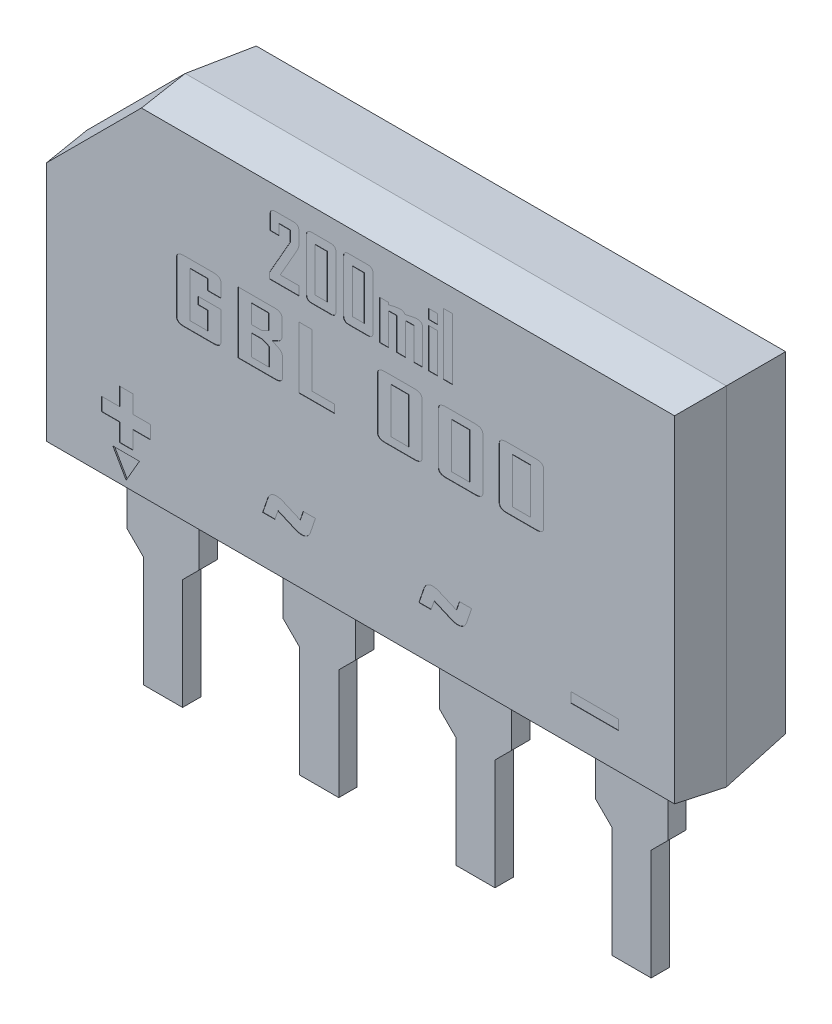
from build123d import *
from OCP.BRepFilletAPI import BRepFilletAPI_MakeChamfer

# Parameters (mm, degrees)
BODY_MAIN_DEPTH            = 1.5
BODY_MAIN_DEPTH_BACK       = 2.2
SKETCH1_W                  = 20.8
SKETCH1_H                  = 11.3
BODY_CHAMFER_SIZE          = 3.2
BODY_CHAMFER1_SIZE         = 1.5
BODY_CHAMFER1_SIZE2        = 0.184176841
BODY_CHAMFER2_SIZE         = 0.270126034
BODY_CHAMFER2_SIZE_2       = 2.2
SKETCH10_W                 = 2.35
SKETCH10_H                 = 0.6
PIN_L1_DEPTH               = 3.2
CHAMFER4_SIZE              = 0.54
SKETCH11_W                 = 1.27
SKETCH11_H                 = 0.6
PIN_STRAIGHT_PATTERN_START = -0.3
PIN_STRAIGHT_PATTERN_DEPTH = 0.6
SKETCH5_W                  = 0.578313253
SKETCH5_H                  = 1.469879518
SKETCH5_W_2                = 0.385542169
SKETCH5_H_2                = 1.421686747
SKETCH5_W_3                = 0.294427711
SKETCH5_H_3                = 0.313253012
SKETCH5_W_4                = 0.289156626
SKETCH5_H_4                = 1.277108434
SKETCH5_H_5                = 2
SKETCH5_W_5                = 1.554216868
SKETCH5_H_6                = 0.325301205
TEXT_2_DEPTH               = 0.01
PIN1_MARK_DEPTH            = 0.04


# Read off the part's stored shape, not the designer's step: PIN_straight_Pattern
with BuildPart() as part:
    # Sketch1 → BODY_MAIN (new, two sides: drawn at the far end of the back side and taken through both)
    with BuildSketch(Plane.XY.offset(-BODY_MAIN_DEPTH_BACK)):
        with Locations((7.62, 8.35)):
            Rectangle(SKETCH1_W, SKETCH1_H)
    extrude(amount=BODY_MAIN_DEPTH + BODY_MAIN_DEPTH_BACK)

    # BODY_Chamfer
    body_chamfer_edges = [part.edges().sort_by_distance(p)[0] for p in [
        (-2.78, 14, -0.35),
    ]]
    chamfer(body_chamfer_edges, length=BODY_CHAMFER_SIZE)

    # BODY_Chamfer1: one chamfer whose edges measure the first distance from different faces: ONE call of the kernel's chamfer builder (chamfer() names one face for all edges)
    body_chamfer1_edges_1 = [part.edges().sort_by_distance(p)[0] for p in [
        (7.62, 2.7, 1.5),
    ]]
    body_chamfer1_side_1 = [part.faces().sort_by_distance(p)[0] for p in [
        (7.62, 2.7, -0.35),
    ]]
    body_chamfer1_edges_2 = [part.edges().sort_by_distance(p)[0] for p in [
        (18.02, 8.35, 1.5),
    ]]
    body_chamfer1_side_2 = [part.faces().sort_by_distance(p)[0] for p in [
        (18.02, 8.35, -0.35),
    ]]
    body_chamfer1_edges_3 = [part.edges().sort_by_distance(p)[0] for p in [
        (9.22, 14, 1.5),
    ]]
    body_chamfer1_side_3 = [part.faces().sort_by_distance(p)[0] for p in [
        (9.22, 14, -0.35),
    ]]
    body_chamfer1_edges_4 = [part.edges().sort_by_distance(p)[0] for p in [
        (-2.78, 6.75, 1.5),
    ]]
    body_chamfer1_side_4 = [part.faces().sort_by_distance(p)[0] for p in [
        (-2.78, 6.75, -0.35),
    ]]
    body_chamfer1_edges_5 = [part.edges().sort_by_distance(p)[0] for p in [
        (-1.18, 12.4, 1.5),
    ]]
    body_chamfer1_side_5 = [part.faces().sort_by_distance(p)[0] for p in [
        (-1.18, 12.4, -0.35),
    ]]
    body_chamfer1 = BRepFilletAPI_MakeChamfer(part.part.solid().wrapped)
    for e in body_chamfer1_edges_1:
        body_chamfer1.Add(BODY_CHAMFER1_SIZE, BODY_CHAMFER1_SIZE2, e.wrapped, body_chamfer1_side_1[0].wrapped)  # the first distance lies on this face
    for e in body_chamfer1_edges_2:
        body_chamfer1.Add(BODY_CHAMFER1_SIZE, BODY_CHAMFER1_SIZE2, e.wrapped, body_chamfer1_side_2[0].wrapped)  # the first distance lies on this face
    for e in body_chamfer1_edges_3:
        body_chamfer1.Add(BODY_CHAMFER1_SIZE, BODY_CHAMFER1_SIZE2, e.wrapped, body_chamfer1_side_3[0].wrapped)  # the first distance lies on this face
    for e in body_chamfer1_edges_4:
        body_chamfer1.Add(BODY_CHAMFER1_SIZE, BODY_CHAMFER1_SIZE2, e.wrapped, body_chamfer1_side_4[0].wrapped)  # the first distance lies on this face
    for e in body_chamfer1_edges_5:
        body_chamfer1.Add(BODY_CHAMFER1_SIZE, BODY_CHAMFER1_SIZE2, e.wrapped, body_chamfer1_side_5[0].wrapped)  # the first distance lies on this face
    add(Compound.cast(body_chamfer1.Shape()), mode=Mode.REPLACE)

    # BODY_Chamfer2
    # the kernel refuses this chamfer: 2.2, 0.270126034 mm, written as the material it takes off along each edge
    with BuildSketch(Plane(origin=(18.02, 19.718423007, -2.2), x_dir=(-0.9548873060039231, 0, -0.29696840376135986), z_dir=(0, -1, 0))) as body_chamfer2_piece_1:
        Polygon((BODY_CHAMFER2_SIZE * 0.954887305956, -BODY_CHAMFER2_SIZE * 0.296968403746), (-BODY_CHAMFER2_SIZE_2 * 0.296968403761, -BODY_CHAMFER2_SIZE_2 * 0.954887306004), (0, 0), align=None)
    extrude(amount=22.736846014, mode=Mode.SUBTRACT)
    with BuildSketch(Plane(origin=(-5.298423007, 14, -2.2), x_dir=(0, 0.004688575069790526, 0.9999890085715016), z_dir=(1, 0, 0))) as body_chamfer2_piece_2:
        Polygon((BODY_CHAMFER2_SIZE_2 * 0.999989008572, BODY_CHAMFER2_SIZE_2 * 0.00468857506979), (-BODY_CHAMFER2_SIZE * 0.00468857506955, BODY_CHAMFER2_SIZE * 0.999989008521), (0, 0), align=None)
    extrude(amount=29.036846014, mode=Mode.SUBTRACT)
    with BuildSketch(Plane(origin=(-2.78, -3.018423007, -2.2), x_dir=(0.9548873060039239, 0, -0.29696840376135725), z_dir=(0, 1, 0))) as body_chamfer2_piece_3:
        Polygon((BODY_CHAMFER2_SIZE * 0.954887305956, -BODY_CHAMFER2_SIZE * 0.296968403746), (-BODY_CHAMFER2_SIZE_2 * 0.296968403761, -BODY_CHAMFER2_SIZE_2 * 0.954887306004), (0, 0), align=None)
    extrude(amount=19.536846014, mode=Mode.SUBTRACT)
    with BuildSketch(Plane(origin=(23.738423007, 2.7, -2.2), x_dir=(0, 0.9548873060039238, -0.2969684037613582), z_dir=(-1, 0, 0))) as body_chamfer2_piece_4:
        Polygon((BODY_CHAMFER2_SIZE * 0.954887305956, -BODY_CHAMFER2_SIZE * 0.296968403746), (-BODY_CHAMFER2_SIZE_2 * 0.296968403761, -BODY_CHAMFER2_SIZE_2 * 0.954887306004), (0, 0), align=None)
    extrude(amount=32.236846014, mode=Mode.SUBTRACT)
    with BuildSketch(Plane(origin=(4.463535686, 18.043535686, -2.2), x_dir=(-0.003315323225951138, 0.0033153232259511387, 0.9999890085715016), z_dir=(-0.7071067811865477, -0.7071067811865475, 0))) as body_chamfer2_piece_5:
        Polygon((BODY_CHAMFER2_SIZE_2 * 0.999989008572, -BODY_CHAMFER2_SIZE_2 * 0.00468857506979), (-BODY_CHAMFER2_SIZE * 0.00468857506955, -BODY_CHAMFER2_SIZE * 0.999989008521), (0, 0), align=None)
    extrude(amount=15.962329414, mode=Mode.SUBTRACT)

    # Sketch10 → PIN_L1 (add)
    with BuildSketch(Plane(origin=(0, 0, 0), x_dir=(1, 0, 0), z_dir=(0, 1, 0))):
        Rectangle(SKETCH10_W, SKETCH10_H)
    extrude(amount=PIN_L1_DEPTH)

    # Chamfer4
    chamfer4_edges = [part.edges().sort_by_distance(p)[0] for p in [
        (1.175, 0, 0),
        (-1.175, 0, 0),
    ]]
    chamfer(chamfer4_edges, length=CHAMFER4_SIZE)

    # PIN_straight: sweep along a path in Sketch12
    with BuildLine(Plane(origin=(0, 0, 0), x_dir=(0, 0, -1), z_dir=(1, 0, 0))) as pin_straight_path:
        Line((0, 0), (0, -3.6))
    # Sketch11 → PIN_straight (sweep)
    with BuildSketch(Plane.XZ):
        Rectangle(SKETCH11_W, SKETCH11_H)
    sweep(path=pin_straight_path.line)

    # PIN_straight_Pattern outline → PIN_straight_Pattern (add)
    with BuildSketch(Plane.XY.offset(PIN_STRAIGHT_PATTERN_START)):
        Polygon((4.445, 0), (4.445, -3.6), (5.715, -3.6), (5.715, 0), (6.255, 0.54), (6.255, 4), (3.905, 4), (3.905, 0.54), align=None)
        Polygon((11.335, 4), (8.985, 4), (8.985, 0.54), (9.525, 0), (9.525, -3.6), (10.795, -3.6), (10.795, 0), (11.335, 0.54), align=None)
        Polygon((16.415, 4), (14.065, 4), (14.065, 0.54), (14.605, 0), (14.605, -3.6), (15.875, -3.6), (15.875, 0), (16.415, 0.54), align=None)
    extrude(amount=PIN_STRAIGHT_PATTERN_DEPTH)

    # Sketch5 → text 2 (cut)
    # profile 1 of 17: a face of its own
    with BuildSketch(Plane.XY.offset(1.5)):
        with BuildLine():
            add(Edge.make_bspline(
                [(3.082650602, 8.507756024), (3.08163088, 8.495704487), (3.079675054, 8.472589642), (3.066855547, 8.440653682), (3.04777922, 8.412986426), (3.020577888, 8.390993313), (2.987213488, 8.373020296), (2.946639807, 8.360745), (2.899487725, 8.352452516), (2.865698113, 8.350852003), (2.847710843, 8.35)],
                knots=[0, 0, 0, 0, 0.912786698, 1.750724646, 2.577393401, 3.435475294, 4.376805661, 5.436517424, 6.635377905, 8, 8, 8, 8], degree=3))
            Line((2.847710843, 8.35), (1.871807229, 8.35))
            add(Edge.make_bspline(
                [(1.871807229, 8.35), (1.85381996, 8.350852003), (1.820030347, 8.352452516), (1.772878265, 8.360745), (1.732304585, 8.373020296), (1.698940184, 8.390993313), (1.671738852, 8.412986426), (1.652662525, 8.440653682), (1.639843018, 8.472589642), (1.637887192, 8.495704487), (1.63686747, 8.507756024)],
                knots=[0, 0, 0, 0, 1.364622095, 2.563482576, 3.623194339, 4.564524706, 5.422606599, 6.249275354, 7.087213302, 8, 8, 8, 8], degree=3))
            Line((1.63686747, 8.507756024), (1.63686747, 10.192243976))
            add(Edge.make_bspline(
                [(1.63686747, 10.192243976), (1.637853058, 10.204308182), (1.639747202, 10.227493683), (1.653092507, 10.259366195), (1.672529947, 10.287165368), (1.700516761, 10.308992917), (1.73458846, 10.326973105), (1.77613875, 10.339345635), (1.824439148, 10.347495523), (1.859094339, 10.349132645), (1.877454819, 10.35)],
                knots=[0, 0, 0, 0, 0.898785286, 1.727323638, 2.546744885, 3.406099796, 4.349527069, 5.410850413, 6.628256588, 8, 8, 8, 8], degree=3))
            Line((1.877454819, 10.35), (2.847710843, 10.35))
            add(Edge.make_bspline(
                [(2.847710843, 10.35), (2.865698113, 10.349147997), (2.899487725, 10.347547484), (2.946639807, 10.339255), (2.987213488, 10.326979704), (3.020577888, 10.309006687), (3.04777922, 10.287013574), (3.066855547, 10.259346318), (3.079675054, 10.227410358), (3.08163088, 10.204295513), (3.082650602, 10.192243976)],
                knots=[0, 0, 0, 0, 1.364622095, 2.563482576, 3.623194339, 4.564524706, 5.422606599, 6.249275354, 7.087213302, 8, 8, 8, 8], degree=3))
            Line((3.082650602, 10.192243976), (3.082650602, 9.747590361))
            Line((3.082650602, 9.747590361), (2.648915663, 9.747590361))
            Line((2.648915663, 9.747590361), (2.648915663, 10.084939759))
            Line((2.648915663, 10.084939759), (2.07060241, 10.084939759))
            Line((2.07060241, 10.084939759), (2.07060241, 8.615060241))
            Line((2.07060241, 8.615060241), (2.648915663, 8.615060241))
            Line((2.648915663, 8.615060241), (2.648915663, 9.193373494))
            Line((2.648915663, 9.193373494), (2.335662651, 9.193373494))
            Line((2.335662651, 9.193373494), (2.335662651, 9.434337349))
            Line((2.335662651, 9.434337349), (3.082650602, 9.434337349))
            Line((3.082650602, 9.434337349), (3.082650602, 8.507756024))
        make_face()
    # profile 2 of 17: a face of its own
    with BuildSketch(Plane.XY.offset(1.5)):
        with BuildLine():
            add(Edge.make_bspline(
                [(5.085060241, 8.507756024), (5.084040519, 8.495704487), (5.082084693, 8.472589642), (5.069265186, 8.440653682), (5.050188859, 8.412986426), (5.022987527, 8.390993313), (4.989623126, 8.373020296), (4.949049446, 8.360745), (4.901897364, 8.352452516), (4.868107751, 8.350852003), (4.850120482, 8.35)],
                knots=[0, 0, 0, 0, 0.912786698, 1.750724646, 2.577393401, 3.435475294, 4.376805661, 5.436517424, 6.635377905, 8, 8, 8, 8], degree=3))
            Line((4.850120482, 8.35), (3.639277108, 8.35))
            Line((3.639277108, 8.35), (3.639277108, 10.35))
            Line((3.639277108, 10.35), (4.842590361, 10.35))
            add(Edge.make_bspline(
                [(4.842590361, 10.35), (4.859952402, 10.349147977), (4.892623353, 10.347544687), (4.938261476, 10.339209), (4.97764134, 10.327012148), (5.009913574, 10.308886478), (5.036343166, 10.28698588), (5.054569012, 10.259194374), (5.066952574, 10.22734698), (5.068954305, 10.204289231), (5.07, 10.192243976)],
                knots=[0, 0, 0, 0, 1.345028062, 2.531001147, 3.585414672, 4.521117009, 5.382572416, 6.215698828, 7.067889818, 8, 8, 8, 8], degree=3))
            Line((5.07, 10.192243976), (5.07, 9.668900602))
            add(Edge.make_bspline(
                [(5.07, 9.668900602), (5.069681218, 9.659728639), (5.069062079, 9.64191483), (5.065097966, 9.61586085), (5.057180424, 9.591811046), (5.04766279, 9.568710753), (5.034128945, 9.547709757), (5.018357686, 9.52788382), (4.999240763, 9.510001415), (4.984789028, 9.49980572), (4.977379518, 9.494578313)],
                knots=[0, 0, 0, 0, 1.067017439, 2.07236394, 3.050976564, 4.005345974, 4.969154372, 5.944714955, 6.946240447, 8, 8, 8, 8], degree=3))
            add(Edge.make_bspline(
                [(4.977379518, 9.494578313), (4.975257254, 9.493303081), (4.96914061, 9.489627697), (4.956501266, 9.483361434), (4.937600562, 9.474365506), (4.912465795, 9.462383671), (4.88113733, 9.447227439), (4.843639716, 9.429222228), (4.799873426, 9.408440715), (4.768556174, 9.393900129), (4.75185241, 9.386144578)],
                knots=[0, 0, 0, 0, 0.237364915, 0.684116738, 1.351591564, 2.245176257, 3.354019085, 4.688968736, 6.233986598, 8, 8, 8, 8], degree=3))
            add(Edge.make_bspline(
                [(4.75185241, 9.386144578), (4.769148789, 9.377938694), (4.801460384, 9.362609172), (4.847090318, 9.341828667), (4.885569801, 9.322489389), (4.918400888, 9.307735118), (4.943951843, 9.294308169), (4.96380449, 9.285322277), (4.976731554, 9.2782713), (4.983157707, 9.274456342), (4.985286145, 9.273192771)],
                knots=[0, 0, 0, 0, 1.771403171, 3.309181819, 4.638758348, 5.755620115, 6.63848141, 7.308497844, 7.770964207, 8, 8, 8, 8], degree=3))
            add(Edge.make_bspline(
                [(4.985286145, 9.273192771), (4.993220217, 9.267611997), (5.008787805, 9.25666186), (5.028993188, 9.237378408), (5.046333991, 9.216678203), (5.060593242, 9.194598541), (5.071888856, 9.170861269), (5.07906759, 9.14536672), (5.084384114, 9.118541675), (5.0848319, 9.100028066), (5.085060241, 9.090587349)],
                knots=[0, 0, 0, 0, 1.069259946, 2.098014239, 3.071585164, 4.043578497, 4.991592967, 5.960027321, 6.959748817, 8, 8, 8, 8], degree=3))
            Line((5.085060241, 9.090587349), (5.085060241, 8.507756024))
        make_face()
        Polygon((4.63626506, 9.611671687), (4.63626506, 10.109036145), (4.073012048, 10.109036145), (4.073012048, 9.506626506), (4.422409639, 9.506626506), align=None, mode=Mode.SUBTRACT)
        Polygon((4.651325301, 8.590963855), (4.651325301, 9.167394578), (4.429939759, 9.265662651), (4.073012048, 9.265662651), (4.073012048, 8.590963855), align=None, mode=Mode.SUBTRACT)
    # profile 3 of 17: a face of its own
    with BuildSketch(Plane.XY.offset(1.5)):
        Polygon((6.774216867, 8.35), (5.617590361, 8.35), (5.617590361, 10.35), (6.051325301, 10.35), (6.051325301, 8.615060241), (6.774216867, 8.615060241), align=None)
    # profile 4 of 17: a face of its own
    with BuildSketch(Plane.XY.offset(1.5)):
        with BuildLine():
            add(Edge.make_bspline(
                [(9.622409639, 8.507756024), (9.621389917, 8.495704487), (9.61943409, 8.472589642), (9.606614583, 8.440653682), (9.587538256, 8.412986426), (9.560336925, 8.390993313), (9.526972524, 8.373020296), (9.486398844, 8.360745), (9.439246761, 8.352452516), (9.405457149, 8.350852003), (9.38746988, 8.35)],
                knots=[0, 0, 0, 0, 0.912786698, 1.750724646, 2.577393401, 3.435475294, 4.376805661, 5.436517424, 6.635377905, 8, 8, 8, 8], degree=3))
            Line((9.38746988, 8.35), (8.411566265, 8.35))
            add(Edge.make_bspline(
                [(8.411566265, 8.35), (8.393578996, 8.350852003), (8.359789383, 8.352452516), (8.312637301, 8.360745), (8.272063621, 8.373020296), (8.23869922, 8.390993313), (8.211497888, 8.412986426), (8.192421561, 8.440653682), (8.179602054, 8.472589642), (8.177646228, 8.495704487), (8.176626506, 8.507756024)],
                knots=[0, 0, 0, 0, 1.364622095, 2.563482576, 3.623194339, 4.564524706, 5.422606599, 6.249275354, 7.087213302, 8, 8, 8, 8], degree=3))
            Line((8.176626506, 8.507756024), (8.176626506, 10.192243976))
            add(Edge.make_bspline(
                [(8.176626506, 10.192243976), (8.177612094, 10.204308182), (8.179506238, 10.227493683), (8.192851544, 10.259366195), (8.212288983, 10.287165368), (8.240275798, 10.308992917), (8.274347496, 10.326973105), (8.315897786, 10.339345635), (8.364198184, 10.347495523), (8.398853375, 10.349132645), (8.417213855, 10.35)],
                knots=[0, 0, 0, 0, 0.898785286, 1.727323638, 2.546744885, 3.406099796, 4.349527069, 5.410850413, 6.628256588, 8, 8, 8, 8], degree=3))
            Line((8.417213855, 10.35), (9.38746988, 10.35))
            add(Edge.make_bspline(
                [(9.38746988, 10.35), (9.405457149, 10.349147997), (9.439246761, 10.347547484), (9.486398844, 10.339255), (9.526972524, 10.326979704), (9.560336925, 10.309006687), (9.587538256, 10.287013574), (9.606614583, 10.259346318), (9.61943409, 10.227410358), (9.621389917, 10.204295513), (9.622409639, 10.192243976)],
                knots=[0, 0, 0, 0, 1.364622095, 2.563482576, 3.623194339, 4.564524706, 5.422606599, 6.249275354, 7.087213302, 8, 8, 8, 8], degree=3))
            Line((9.622409639, 10.192243976), (9.622409639, 8.507756024))
        make_face()
        with Locations((8.899518073, 9.35)):
            Rectangle(SKETCH5_W, SKETCH5_H, mode=Mode.SUBTRACT)
    # profile 5 of 17: a face of its own
    with BuildSketch(Plane.XY.offset(1.5)):
        with BuildLine():
            add(Edge.make_bspline(
                [(11.600722892, 8.507756024), (11.59970317, 8.495704487), (11.597747343, 8.472589642), (11.584927836, 8.440653682), (11.565851509, 8.412986426), (11.538650178, 8.390993313), (11.505285777, 8.373020296), (11.464712097, 8.360745), (11.417560014, 8.352452516), (11.383770402, 8.350852003), (11.365783133, 8.35)],
                knots=[0, 0, 0, 0, 0.912786698, 1.750724646, 2.577393401, 3.435475294, 4.376805661, 5.436517424, 6.635377905, 8, 8, 8, 8], degree=3))
            Line((11.365783133, 8.35), (10.389879518, 8.35))
            add(Edge.make_bspline(
                [(10.389879518, 8.35), (10.371892249, 8.350852003), (10.338102636, 8.352452516), (10.290950554, 8.360745), (10.250376874, 8.373020296), (10.217012473, 8.390993313), (10.189811141, 8.412986426), (10.170734814, 8.440653682), (10.157915307, 8.472589642), (10.155959481, 8.495704487), (10.154939759, 8.507756024)],
                knots=[0, 0, 0, 0, 1.364622095, 2.563482576, 3.623194339, 4.564524706, 5.422606599, 6.249275354, 7.087213302, 8, 8, 8, 8], degree=3))
            Line((10.154939759, 8.507756024), (10.154939759, 10.192243976))
            add(Edge.make_bspline(
                [(10.154939759, 10.192243976), (10.155925347, 10.204308182), (10.157819491, 10.227493683), (10.171164797, 10.259366195), (10.190602236, 10.287165368), (10.218589051, 10.308992917), (10.252660749, 10.326973105), (10.294211039, 10.339345635), (10.342511437, 10.347495523), (10.377166628, 10.349132645), (10.395527108, 10.35)],
                knots=[0, 0, 0, 0, 0.898785286, 1.727323638, 2.546744885, 3.406099796, 4.349527069, 5.410850413, 6.628256588, 8, 8, 8, 8], degree=3))
            Line((10.395527108, 10.35), (11.365783133, 10.35))
            add(Edge.make_bspline(
                [(11.365783133, 10.35), (11.383770402, 10.349147997), (11.417560014, 10.347547484), (11.464712097, 10.339255), (11.505285777, 10.326979704), (11.538650178, 10.309006687), (11.565851509, 10.287013574), (11.584927836, 10.259346318), (11.597747343, 10.227410358), (11.59970317, 10.204295513), (11.600722892, 10.192243976)],
                knots=[0, 0, 0, 0, 1.364622095, 2.563482576, 3.623194339, 4.564524706, 5.422606599, 6.249275354, 7.087213302, 8, 8, 8, 8], degree=3))
            Line((11.600722892, 10.192243976), (11.600722892, 8.507756024))
        make_face()
        with Locations((10.877831326, 9.35)):
            Rectangle(SKETCH5_W, SKETCH5_H, mode=Mode.SUBTRACT)
    # profile 6 of 17: a face of its own
    with BuildSketch(Plane.XY.offset(1.5)):
        with BuildLine():
            add(Edge.make_bspline(
                [(13.579036145, 8.507756024), (13.578016423, 8.495704487), (13.576060596, 8.472589642), (13.563241089, 8.440653682), (13.544164762, 8.412986426), (13.516963431, 8.390993313), (13.48359903, 8.373020296), (13.44302535, 8.360745), (13.395873267, 8.352452516), (13.362083655, 8.350852003), (13.344096386, 8.35)],
                knots=[0, 0, 0, 0, 0.912786698, 1.750724646, 2.577393401, 3.435475294, 4.376805661, 5.436517424, 6.635377905, 8, 8, 8, 8], degree=3))
            Line((13.344096386, 8.35), (12.368192771, 8.35))
            add(Edge.make_bspline(
                [(12.368192771, 8.35), (12.350205502, 8.350852003), (12.316415889, 8.352452516), (12.269263807, 8.360745), (12.228690127, 8.373020296), (12.195325726, 8.390993313), (12.168124394, 8.412986426), (12.149048067, 8.440653682), (12.136228561, 8.472589642), (12.134272734, 8.495704487), (12.133253012, 8.507756024)],
                knots=[0, 0, 0, 0, 1.364622095, 2.563482576, 3.623194339, 4.564524706, 5.422606599, 6.249275354, 7.087213302, 8, 8, 8, 8], degree=3))
            Line((12.133253012, 8.507756024), (12.133253012, 10.192243976))
            add(Edge.make_bspline(
                [(12.133253012, 10.192243976), (12.1342386, 10.204308182), (12.136132744, 10.227493683), (12.14947805, 10.259366195), (12.168915489, 10.287165368), (12.196902304, 10.308992917), (12.230974002, 10.326973105), (12.272524292, 10.339345635), (12.32082469, 10.347495523), (12.355479881, 10.349132645), (12.373840361, 10.35)],
                knots=[0, 0, 0, 0, 0.898785286, 1.727323638, 2.546744885, 3.406099796, 4.349527069, 5.410850413, 6.628256588, 8, 8, 8, 8], degree=3))
            Line((12.373840361, 10.35), (13.344096386, 10.35))
            add(Edge.make_bspline(
                [(13.344096386, 10.35), (13.362083655, 10.349147997), (13.395873267, 10.347547484), (13.44302535, 10.339255), (13.48359903, 10.326979704), (13.516963431, 10.309006687), (13.544164762, 10.287013574), (13.563241089, 10.259346318), (13.576060596, 10.227410358), (13.578016423, 10.204295513), (13.579036145, 10.192243976)],
                knots=[0, 0, 0, 0, 1.364622095, 2.563482576, 3.623194339, 4.564524706, 5.422606599, 6.249275354, 7.087213302, 8, 8, 8, 8], degree=3))
            Line((13.579036145, 10.192243976), (13.579036145, 8.507756024))
        make_face()
        with Locations((12.856144579, 9.35)):
            Rectangle(SKETCH5_W, SKETCH5_H, mode=Mode.SUBTRACT)
    # profile 7 of 17: a face of its own
    with BuildSketch(Plane.XY.offset(1.5)):
        with BuildLine():
            add(Edge.make_bspline(
                [(5.62, 12.534718808), (5.61912135, 12.518584812), (5.617293817, 12.485027199), (5.604221632, 12.433853518), (5.584394731, 12.380007868), (5.565494647, 12.344872636), (5.55561747, 12.326510977)],
                knots=[0, 0, 0, 0, 0.878890772, 1.828032848, 2.864930751, 4, 4, 4, 4], degree=3))
            Line((5.55561747, 12.326510977), (5.011942771, 11.372068206))
            Line((5.011942771, 11.372068206), (5.62, 11.372068206))
            Line((5.62, 11.372068206), (5.62, 11.082911579))
            Line((5.62, 11.082911579), (4.656144578, 11.082911579))
            Line((4.656144578, 11.082911579), (4.656144578, 11.263634471))
            Line((4.656144578, 11.263634471), (5.330843373, 12.448122423))
            Line((5.330843373, 12.448122423), (5.330843373, 12.793754953))
            Line((5.330843373, 12.793754953), (4.96939759, 12.793754953))
            Line((4.96939759, 12.793754953), (4.96939759, 12.456405555))
            Line((4.96939759, 12.456405555), (4.680240964, 12.456405555))
            Line((4.680240964, 12.456405555), (4.680240964, 12.925155555))
            add(Edge.make_bspline(
                [(4.680240964, 12.925155555), (4.681091559, 12.93714037), (4.682698142, 12.959776968), (4.691222482, 12.991335154), (4.703730333, 13.018780376), (4.722170371, 13.040982172), (4.744372167, 13.059422211), (4.771817389, 13.071930061), (4.803375576, 13.080454402), (4.826012173, 13.082060984), (4.837996988, 13.082911579)],
                knots=[0, 0, 0, 0, 1.144701434, 2.162081395, 3.105417678, 4, 4.894582322, 5.837918605, 6.855298566, 8, 8, 8, 8], degree=3))
            Line((4.837996988, 13.082911579), (5.462243976, 13.082911579))
            add(Edge.make_bspline(
                [(5.462243976, 13.082911579), (5.474228791, 13.082060984), (5.496865388, 13.080454402), (5.528423574, 13.071930061), (5.555868796, 13.059422211), (5.578070592, 13.040982172), (5.596510631, 13.018780376), (5.609018482, 12.991335154), (5.617542822, 12.959776968), (5.619149404, 12.93714037), (5.62, 12.925155555)],
                knots=[0, 0, 0, 0, 1.144701434, 2.162081395, 3.105417678, 4, 4.894582322, 5.837918605, 6.855298566, 8, 8, 8, 8], degree=3))
            Line((5.62, 12.925155555), (5.62, 12.534718808))
        make_face()
    # profile 8 of 17: a face of its own
    with BuildSketch(Plane.XY.offset(1.5)):
        with BuildLine():
            add(Edge.make_bspline(
                [(6.824819277, 11.240667603), (6.823968682, 11.228682788), (6.822362099, 11.206046191), (6.813837759, 11.174488005), (6.801329908, 11.147042783), (6.78288987, 11.124840987), (6.760688074, 11.106400948), (6.733242852, 11.093893098), (6.701684665, 11.085368757), (6.679048068, 11.083762175), (6.667063253, 11.082911579)],
                knots=[0, 0, 0, 0, 1.144701434, 2.162081395, 3.105417678, 4, 4.894582322, 5.837918605, 6.855298566, 8, 8, 8, 8], degree=3))
            Line((6.667063253, 11.082911579), (6.01871988, 11.082911579))
            add(Edge.make_bspline(
                [(6.01871988, 11.082911579), (6.006735065, 11.083762175), (5.984098467, 11.085368757), (5.952540281, 11.093893098), (5.925095059, 11.106400948), (5.902893263, 11.124840987), (5.884453224, 11.147042783), (5.871945374, 11.174488005), (5.863421033, 11.206046191), (5.861814451, 11.228682788), (5.860963855, 11.240667603)],
                knots=[0, 0, 0, 0, 1.144701434, 2.162081395, 3.105417678, 4, 4.894582322, 5.837918605, 6.855298566, 8, 8, 8, 8], degree=3))
            Line((5.860963855, 11.240667603), (5.860963855, 12.925155555))
            add(Edge.make_bspline(
                [(5.860963855, 12.925155555), (5.861777615, 12.937149056), (5.863316877, 12.959835281), (5.872341843, 12.991367061), (5.885213508, 13.01882083), (5.904048531, 13.040992607), (5.926697595, 13.059532599), (5.954942544, 13.071981967), (5.987383983, 13.080402932), (6.010629491, 13.082046645), (6.022861446, 13.082911579)],
                knots=[0, 0, 0, 0, 1.129786222, 2.13703947, 3.073253258, 3.963672955, 4.855819033, 5.808252896, 6.846686804, 8, 8, 8, 8], degree=3))
            Line((6.022861446, 13.082911579), (6.667063253, 13.082911579))
            add(Edge.make_bspline(
                [(6.667063253, 13.082911579), (6.679048068, 13.082060984), (6.701684665, 13.080454402), (6.733242852, 13.071930061), (6.760688074, 13.059422211), (6.78288987, 13.040982172), (6.801329908, 13.018780376), (6.813837759, 12.991335154), (6.822362099, 12.959776968), (6.823968682, 12.93714037), (6.824819277, 12.925155555)],
                knots=[0, 0, 0, 0, 1.144701434, 2.162081395, 3.105417678, 4, 4.894582322, 5.837918605, 6.855298566, 8, 8, 8, 8], degree=3))
            Line((6.824819277, 12.925155555), (6.824819277, 11.240667603))
        make_face()
        with Locations((6.342891567, 12.08291158)):
            Rectangle(SKETCH5_W_2, SKETCH5_H_2, mode=Mode.SUBTRACT)
    # profile 9 of 17: a face of its own
    with BuildSketch(Plane.XY.offset(1.5)):
        with BuildLine():
            add(Edge.make_bspline(
                [(8.029638554, 11.240667603), (8.028787959, 11.228682788), (8.027181376, 11.206046191), (8.018657036, 11.174488005), (8.006149185, 11.147042783), (7.987709147, 11.124840987), (7.965507351, 11.106400948), (7.938062129, 11.093893098), (7.906503942, 11.085368757), (7.883867345, 11.083762175), (7.87188253, 11.082911579)],
                knots=[0, 0, 0, 0, 1.144701434, 2.162081395, 3.105417678, 4, 4.894582322, 5.837918605, 6.855298566, 8, 8, 8, 8], degree=3))
            Line((7.87188253, 11.082911579), (7.223539157, 11.082911579))
            add(Edge.make_bspline(
                [(7.223539157, 11.082911579), (7.211554342, 11.083762175), (7.188917744, 11.085368757), (7.157359558, 11.093893098), (7.129914336, 11.106400948), (7.10771254, 11.124840987), (7.089272501, 11.147042783), (7.076764651, 11.174488005), (7.06824031, 11.206046191), (7.066633728, 11.228682788), (7.065783133, 11.240667603)],
                knots=[0, 0, 0, 0, 1.144701434, 2.162081395, 3.105417678, 4, 4.894582322, 5.837918605, 6.855298566, 8, 8, 8, 8], degree=3))
            Line((7.065783133, 11.240667603), (7.065783133, 12.925155555))
            add(Edge.make_bspline(
                [(7.065783133, 12.925155555), (7.066596892, 12.937149056), (7.068136154, 12.959835281), (7.077161121, 12.991367061), (7.090032785, 13.01882083), (7.108867808, 13.040992607), (7.131516872, 13.059532599), (7.159761821, 13.071981967), (7.19220326, 13.080402932), (7.215448768, 13.082046645), (7.227680723, 13.082911579)],
                knots=[0, 0, 0, 0, 1.129786222, 2.13703947, 3.073253258, 3.963672955, 4.855819033, 5.808252896, 6.846686804, 8, 8, 8, 8], degree=3))
            Line((7.227680723, 13.082911579), (7.87188253, 13.082911579))
            add(Edge.make_bspline(
                [(7.87188253, 13.082911579), (7.883867345, 13.082060984), (7.906503942, 13.080454402), (7.938062129, 13.071930061), (7.965507351, 13.059422211), (7.987709147, 13.040982172), (8.006149185, 13.018780376), (8.018657036, 12.991335154), (8.027181376, 12.959776968), (8.028787959, 12.93714037), (8.029638554, 12.925155555)],
                knots=[0, 0, 0, 0, 1.144701434, 2.162081395, 3.105417678, 4, 4.894582322, 5.837918605, 6.855298566, 8, 8, 8, 8], degree=3))
            Line((8.029638554, 12.925155555), (8.029638554, 11.240667603))
        make_face()
        with Locations((7.547710844, 12.08291158)):
            Rectangle(SKETCH5_W_2, SKETCH5_H_2, mode=Mode.SUBTRACT)
    # profile 10 of 17: a face of its own
    with BuildSketch(Plane.XY.offset(1.5)):
        with BuildLine():
            Line((9.644096386, 11.082911579), (9.354939759, 11.082911579))
            Line((9.354939759, 11.082911579), (9.354939759, 12.119056158))
            Line((9.354939759, 12.119056158), (9.089879518, 12.116044109))
            Line((9.089879518, 12.116044109), (9.089879518, 11.082911579))
            Line((9.089879518, 11.082911579), (8.800722892, 11.082911579))
            Line((8.800722892, 11.082911579), (8.800722892, 12.119056158))
            Line((8.800722892, 12.119056158), (8.535662651, 12.116044109))
            Line((8.535662651, 12.116044109), (8.535662651, 11.082911579))
            Line((8.535662651, 11.082911579), (8.246506024, 11.082911579))
            Line((8.246506024, 11.082911579), (8.246506024, 12.360020013))
            Line((8.246506024, 12.360020013), (8.535662651, 12.360020013))
            Line((8.535662651, 12.360020013), (8.535662651, 12.293754953))
            add(Edge.make_bspline(
                [(8.535662651, 12.293754953), (8.567667117, 12.300776456), (8.631556328, 12.314793195), (8.69542815, 12.328888955), (8.727304217, 12.335923628)],
                knots=[0, 0, 0, 0, 1.001873907, 2, 2, 2, 2], degree=3))
            add(Edge.make_bspline(
                [(8.727304217, 12.335923628), (8.745849633, 12.33960481), (8.781319843, 12.34664549), (8.832335347, 12.354067611), (8.878437502, 12.359008979), (8.907514506, 12.359696369), (8.921204819, 12.360020013)],
                knots=[0, 0, 0, 0, 1.159213511, 2.217127275, 3.160570827, 4, 4, 4, 4], degree=3))
            add(Edge.make_bspline(
                [(8.921204819, 12.360020013), (8.930001265, 12.359825169), (8.946787554, 12.359453346), (8.970795782, 12.356058102), (8.992242752, 12.350420926), (9.011586327, 12.343011168), (9.028317651, 12.332665824), (9.042659888, 12.320206382), (9.054922582, 12.30563805), (9.060370358, 12.2942761), (9.06314759, 12.288483868)],
                knots=[0, 0, 0, 0, 1.249781828, 2.384963057, 3.436325833, 4.396912797, 5.317757292, 6.215507025, 7.090279742, 8, 8, 8, 8], degree=3))
            add(Edge.make_bspline(
                [(9.06314759, 12.288483868), (9.097296715, 12.295451958), (9.165645406, 12.309398431), (9.233842937, 12.324066239), (9.267966867, 12.331405555)],
                knots=[0, 0, 0, 0, 0.999261983, 2, 2, 2, 2], degree=3))
            add(Edge.make_bspline(
                [(9.267966867, 12.331405555), (9.289150392, 12.335690785), (9.328900591, 12.34373188), (9.384757236, 12.35283502), (9.432760397, 12.358551145), (9.462106811, 12.35956157), (9.475421687, 12.360020013)],
                knots=[0, 0, 0, 0, 1.236566788, 2.320377627, 3.23793203, 4, 4, 4, 4], degree=3))
            add(Edge.make_bspline(
                [(9.475421687, 12.360020013), (9.488390943, 12.359418685), (9.512962021, 12.358279431), (9.547332062, 12.350474844), (9.576638221, 12.337548246), (9.601042216, 12.320051594), (9.62021374, 12.297317946), (9.633708141, 12.269651265), (9.641991456, 12.237360865), (9.643370689, 12.214364009), (9.644096386, 12.202263989)],
                knots=[0, 0, 0, 0, 1.186326658, 2.247571019, 3.203642386, 4.099401687, 4.971289667, 5.895665404, 6.892783752, 8, 8, 8, 8], degree=3))
            Line((9.644096386, 12.202263989), (9.644096386, 11.082911579))
        make_face()
    # profile 11 of 17: a face of its own
    with BuildSketch(Plane.XY.offset(1.5)):
        with Locations((9.981445783, 12.685321218)):
            Rectangle(SKETCH5_W_3, SKETCH5_H_3)
    # profile 12 of 17: a face of its own
    with BuildSketch(Plane.XY.offset(1.5)):
        with Locations((9.981445783, 11.721465796)):
            Rectangle(SKETCH5_W_4, SKETCH5_H_4)
    # profile 13 of 17: a face of its own
    with BuildSketch(Plane.XY.offset(1.5)):
        with Locations((10.463373494, 12.082911579)):
            Rectangle(SKETCH5_W_4, SKETCH5_H_5)
    # profile 14 of 17: a face of its own
    with BuildSketch(Plane.XY.offset(1.5)):
        Polygon((0.795180723, 4.615597507), (0.21686747, 4.615597507), (0.21686747, 4.037284254), (-0.21686747, 4.037284254), (-0.21686747, 4.615597507), (-0.795180723, 4.615597507), (-0.795180723, 5.049332447), (-0.21686747, 5.049332447), (-0.21686747, 5.6276457), (0.21686747, 5.6276457), (0.21686747, 5.049332447), (0.795180723, 5.049332447), align=None)
    # profile 15 of 17: a face of its own
    with BuildSketch(Plane.XY.offset(1.5)):
        with Locations((15.24, 4.199934857)):
            Rectangle(SKETCH5_W_5, SKETCH5_H_6)
    # profile 16 of 17: a face of its own
    with BuildSketch(Plane.XY.offset(1.5)):
        with BuildLine():
            add(Edge.make_bspline(
                [(5.999691265, 4.626327929), (5.993007986, 4.608423202), (5.980127168, 4.573915066), (5.953806291, 4.527176574), (5.923547774, 4.487210082), (5.888281049, 4.454795566), (5.848703645, 4.42957312), (5.804613016, 4.411325756), (5.756055644, 4.400410481), (5.722263515, 4.399300703), (5.704887048, 4.398730037)],
                knots=[0, 0, 0, 0, 1.140595411, 2.198292223, 3.192843864, 4.124385214, 5.044994205, 5.983033816, 6.962842946, 8, 8, 8, 8], degree=3))
            add(Edge.make_bspline(
                [(5.704887048, 4.398730037), (5.687339788, 4.399449365), (5.650846337, 4.400945367), (5.594901438, 4.411548042), (5.536332767, 4.429533132), (5.497132415, 4.445302174), (5.476724398, 4.453511664)],
                knots=[0, 0, 0, 0, 0.891392593, 1.853850235, 2.88269722, 4, 4, 4, 4], degree=3))
            Line((5.476724398, 4.453511664), (4.93625, 4.687886664))
            Line((4.93625, 4.687886664), (4.837981928, 4.398730037))
            Line((4.837981928, 4.398730037), (4.440391566, 4.398730037))
            Line((4.440391566, 4.398730037), (4.597959337, 4.861267688))
            add(Edge.make_bspline(
                [(4.597959337, 4.861267688), (4.604707268, 4.878947381), (4.617679002, 4.912933546), (4.643002694, 4.959433906), (4.673969585, 4.99836176), (4.709143104, 5.030440081), (4.748989187, 5.055238793), (4.793324333, 5.072850719), (4.842157426, 5.083818252), (4.876326182, 5.084913787), (4.893893072, 5.085477025)],
                knots=[0, 0, 0, 0, 1.133457741, 2.178877341, 3.158549732, 4.101139904, 5.018407234, 5.95490082, 6.948570622, 8, 8, 8, 8], degree=3))
            add(Edge.make_bspline(
                [(4.893893072, 5.085477025), (4.910689351, 5.084752196), (4.945876936, 5.083233704), (5.000274504, 5.072480899), (5.057936453, 5.054680664), (5.096754804, 5.038909583), (5.116972892, 5.030695399)],
                knots=[0, 0, 0, 0, 0.871622166, 1.826016328, 2.867705877, 4, 4, 4, 4], degree=3))
            Line((5.116972892, 5.030695399), (5.660271084, 4.796320399))
            Line((5.660271084, 4.796320399), (5.758539157, 5.085477025))
            Line((5.758539157, 5.085477025), (6.156129518, 5.085477025))
            Line((6.156129518, 5.085477025), (5.999691265, 4.626327929))
        make_face()
    # profile 17 of 17: a face of its own
    with BuildSketch(Plane.XY.offset(1.5)):
        with BuildLine():
            add(Edge.make_bspline(
                [(11.079691265, 4.626327929), (11.073007986, 4.608423202), (11.060127168, 4.573915066), (11.033806291, 4.527176574), (11.003547774, 4.487210082), (10.968281049, 4.454795566), (10.928703645, 4.42957312), (10.884613016, 4.411325756), (10.836055644, 4.400410481), (10.802263515, 4.399300703), (10.784887048, 4.398730037)],
                knots=[0, 0, 0, 0, 1.140595411, 2.198292223, 3.192843864, 4.124385214, 5.044994205, 5.983033816, 6.962842946, 8, 8, 8, 8], degree=3))
            add(Edge.make_bspline(
                [(10.784887048, 4.398730037), (10.767339788, 4.399449365), (10.730846337, 4.400945367), (10.674901438, 4.411548042), (10.616332767, 4.429533132), (10.577132415, 4.445302174), (10.556724398, 4.453511664)],
                knots=[0, 0, 0, 0, 0.891392593, 1.853850235, 2.88269722, 4, 4, 4, 4], degree=3))
            Line((10.556724398, 4.453511664), (10.01625, 4.687886664))
            Line((10.01625, 4.687886664), (9.917981928, 4.398730037))
            Line((9.917981928, 4.398730037), (9.520391566, 4.398730037))
            Line((9.520391566, 4.398730037), (9.677959337, 4.861267688))
            add(Edge.make_bspline(
                [(9.677959337, 4.861267688), (9.684707268, 4.878947381), (9.697679002, 4.912933546), (9.723002694, 4.959433906), (9.753969585, 4.99836176), (9.789143104, 5.030440081), (9.828989187, 5.055238793), (9.873324333, 5.072850719), (9.922157426, 5.083818252), (9.956326182, 5.084913787), (9.973893072, 5.085477025)],
                knots=[0, 0, 0, 0, 1.133457741, 2.178877341, 3.158549732, 4.101139904, 5.018407234, 5.95490082, 6.948570622, 8, 8, 8, 8], degree=3))
            add(Edge.make_bspline(
                [(9.973893072, 5.085477025), (9.990689351, 5.084752196), (10.025876936, 5.083233704), (10.080274504, 5.072480899), (10.137936453, 5.054680664), (10.176754804, 5.038909583), (10.196972892, 5.030695399)],
                knots=[0, 0, 0, 0, 0.871622166, 1.826016328, 2.867705877, 4, 4, 4, 4], degree=3))
            Line((10.196972892, 5.030695399), (10.740271084, 4.796320399))
            Line((10.740271084, 4.796320399), (10.838539157, 5.085477025))
            Line((10.838539157, 5.085477025), (11.236129518, 5.085477025))
            Line((11.236129518, 5.085477025), (11.079691265, 4.626327929))
        make_face()
    extrude(amount=-TEXT_2_DEPTH, mode=Mode.SUBTRACT)

    # Sketch16 → pin1_mark (cut)
    with BuildSketch(Plane.XY.offset(1.5)):
        Polygon((0, 3.084176841), (0.433012702, 3.834176841), (-0.433012702, 3.834176841), align=None)
    extrude(amount=-PIN1_MARK_DEPTH, mode=Mode.SUBTRACT)


solid = part.part
